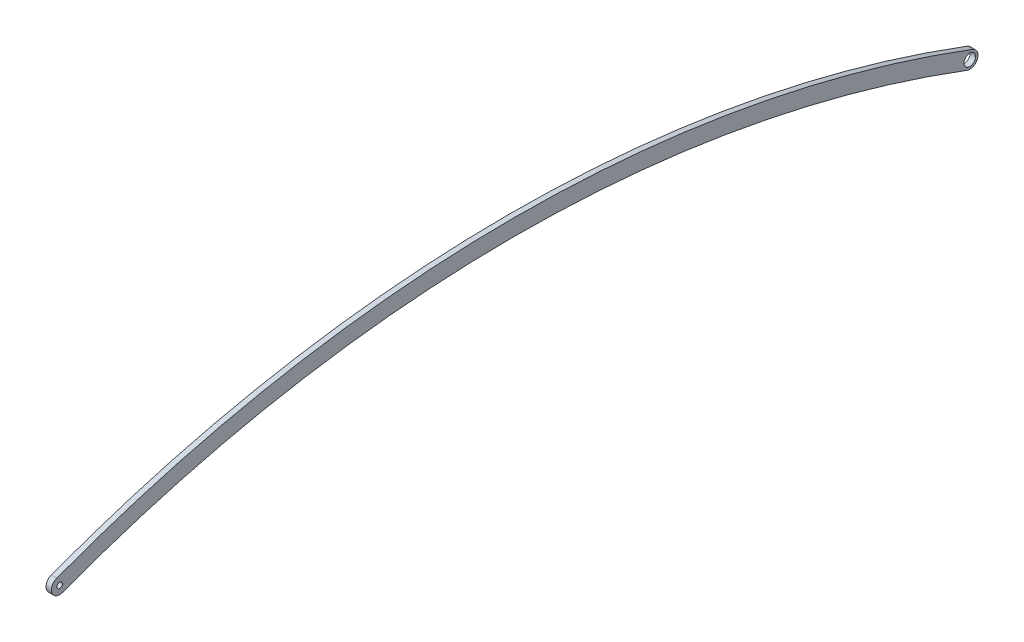
from build123d import *

# Parameters (mm, degrees)
SKETCH1_R           = 1.6
SKETCH1_R_2         = 3.3782
BOSS_EXTRUDE1_DEPTH = 3.175


with BuildPart() as part:
    # Sketch1 → Boss-Extrude1 (new body)
    with BuildSketch(Plane(origin=(0, 0, 0), x_dir=(0, 0, -1), z_dir=(1, 0, 0))):
        with BuildLine():
            ThreePointArc((-1.681648977, 4.455722497), (-4.455722497, -1.681648977), (1.681648977, -4.455722497))
            ThreePointArc((1.681648977, -4.455722497), (264.57943909, 43.503827192), (527.477229203, -4.455722497))
            ThreePointArc((527.477229203, -4.455722497), (533.614600677, -1.681648977), (530.840527157, 4.455722497))
            ThreePointArc((530.840527157, 4.455722497), (264.57943909, 53.028827192), (-1.681648977, 4.455722497))
        make_face()
        Circle(SKETCH1_R, mode=Mode.SUBTRACT)
        with Locations((529.15887818, 0)):
            Circle(SKETCH1_R_2, mode=Mode.SUBTRACT)
    extrude(amount=BOSS_EXTRUDE1_DEPTH)


solid = part.part
